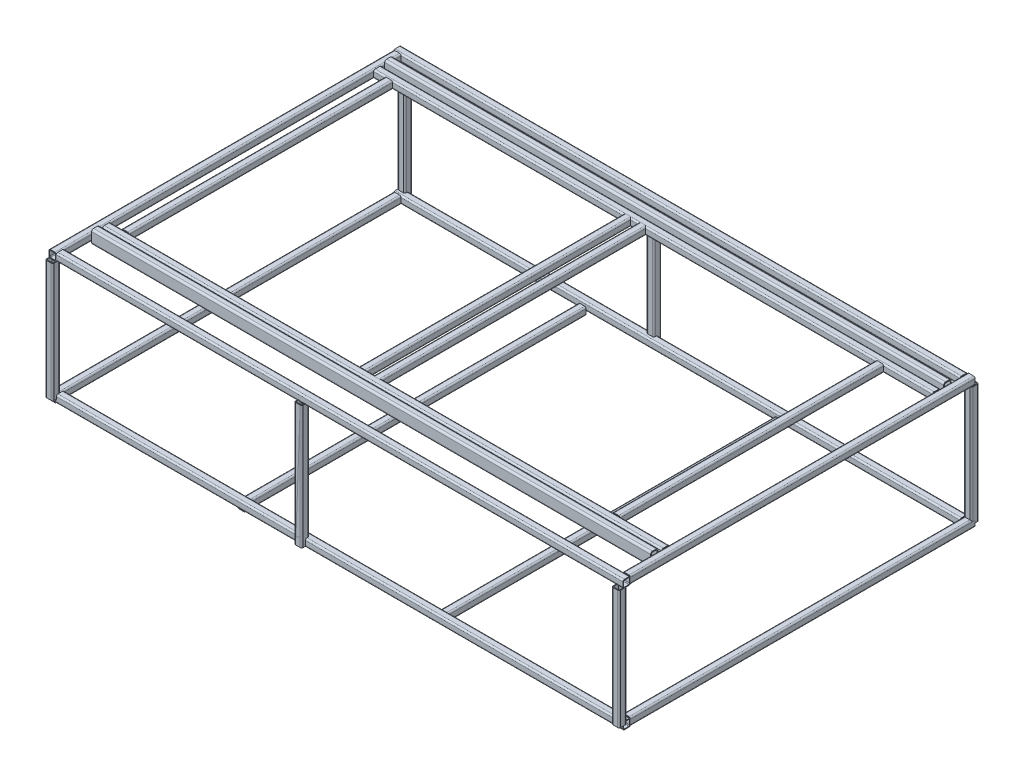
from build123d import *

# Parameters (mm, degrees)
SQUARE_TUBE_40_X_40_X_4_1_DEPTH        = 1845
SQUARE_TUBE_40_X_40_X_4_1_DEPTH_BACK   = 1
SQUARE_TUBE_40_X_40_X_4_1_2_DEPTH      = 3021
SQUARE_TUBE_40_X_40_X_4_1_3_DEPTH      = 1846
SQUARE_TUBE_40_X_40_X_4_1_4_DEPTH      = 3021
RECTANGULAR_TUBE_70_X_40_X_5_1_DEPTH   = 2960
RECTANGULAR_TUBE_70_X_40_X_5_1_2_DEPTH = 2960
SQUARE_TUBE_40_X_40_X_4_2_DEPTH        = 2960
SQUARE_TUBE_40_X_40_X_4_2_2_DEPTH      = 2960
SQUARE_TUBE_40_X_40_X_4_3_DEPTH        = 1395
SQUARE_TUBE_40_X_40_X_4_3_2_DEPTH      = 1395
SQUARE_TUBE_40_X_40_X_4_4_DEPTH        = 1411
SQUARE_TUBE_40_X_40_X_4_4_2_DEPTH      = 1407
SQUARE_TUBE_40_X_40_X_4_5_DEPTH        = 630
SQUARE_TUBE_40_X_40_X_4_5_2_DEPTH      = 653
SQUARE_TUBE_40_X_40_X_4_5_3_DEPTH      = 630
SQUARE_TUBE_40_X_40_X_4_6_DEPTH        = 630
SQUARE_TUBE_40_X_40_X_4_6_2_DEPTH      = 653
SQUARE_TUBE_40_X_40_X_4_6_3_DEPTH      = 630
SQUARE_TUBE_40_X_40_X_4_7_DEPTH        = 630
SQUARE_TUBE_40_X_40_X_4_7_2_DEPTH      = 653
SQUARE_TUBE_40_X_40_X_4_7_3_DEPTH      = 630
SQUARE_TUBE_40_X_40_X_4_8_DEPTH        = 3020
SQUARE_TUBE_40_X_40_X_4_8_DEPTH_BACK   = 1
SQUARE_TUBE_40_X_40_X_4_8_2_DEPTH      = 1846
SQUARE_TUBE_40_X_40_X_4_8_3_DEPTH      = 3021
SQUARE_TUBE_40_X_40_X_4_8_4_DEPTH      = 1846
SQUARE_TUBE_40_X_40_X_4_9_DEPTH        = 1789
SQUARE_TUBE_40_X_40_X_4_9_2_DEPTH      = 1805


with BuildPart() as part:
    # Sketch13 → Square tube 40 X 40 X 4(1) (new, two sides: drawn at the far end of the back side and taken through both)
    with BuildSketch(Plane(origin=(-1500, 0, -912.5), x_dir=(1, 0, 0), z_dir=(0, 0, 1)).offset(-SQUARE_TUBE_40_X_40_X_4_1_DEPTH_BACK)):
        with BuildLine():
            Line((-12, -20), (12, -20))
            ThreePointArc((12, -20), (17.656854249, -17.656854249), (20, -12))
            Line((20, -12), (20, 12))
            ThreePointArc((20, 12), (17.656854249, 17.656854249), (12, 20))
            Line((12, 20), (-12, 20))
            ThreePointArc((-12, 20), (-17.656854249, 17.656854249), (-20, 12))
            Line((-20, 12), (-20, -12))
            ThreePointArc((-20, -12), (-17.656854249, -17.656854249), (-12, -20))
        make_face()
        with BuildLine():
            Line((-12, -16), (12, -16))
            ThreePointArc((12, -16), (14.828427125, -14.828427125), (16, -12))
            Line((16, -12), (16, 12))
            ThreePointArc((16, 12), (14.828427125, 14.828427125), (12, 16))
            Line((12, 16), (-12, 16))
            ThreePointArc((-12, 16), (-14.828427125, 14.828427125), (-16, 12))
            Line((-16, 12), (-16, -12))
            ThreePointArc((-16, -12), (-14.828427125, -14.828427125), (-12, -16))
        make_face(mode=Mode.SUBTRACT)
    extrude(amount=SQUARE_TUBE_40_X_40_X_4_1_DEPTH + SQUARE_TUBE_40_X_40_X_4_1_DEPTH_BACK)

    # Square tube 40 X 40 X 4(1) end butt 1
    split(bisect_by=Plane(origin=(-1500, 0, -892.5), x_dir=(0, -1, 0), z_dir=(0, 0, 1)), keep=Keep.TOP)


with BuildPart() as body_2:
    # Sketch13 on segment 2 (carried to segment 2) → Square tube 40 X 40 X 4_1 2 (new body)
    with BuildSketch(Plane(origin=(-1501, 0, 912.5), x_dir=(0, 0, -1), z_dir=(1, 0, 0))):
        with BuildLine():
            Line((-12, -20), (12, -20))
            ThreePointArc((12, -20), (17.656854249, -17.656854249), (20, -12))
            Line((20, -12), (20, 12))
            ThreePointArc((20, 12), (17.656854249, 17.656854249), (12, 20))
            Line((12, 20), (-12, 20))
            ThreePointArc((-12, 20), (-17.656854249, 17.656854249), (-20, 12))
            Line((-20, 12), (-20, -12))
            ThreePointArc((-20, -12), (-17.656854249, -17.656854249), (-12, -20))
        make_face()
        with BuildLine():
            Line((-12, -16), (12, -16))
            ThreePointArc((12, -16), (14.828427125, -14.828427125), (16, -12))
            Line((16, -12), (16, 12))
            ThreePointArc((16, 12), (14.828427125, 14.828427125), (12, 16))
            Line((12, 16), (-12, 16))
            ThreePointArc((-12, 16), (-14.828427125, 14.828427125), (-16, 12))
            Line((-16, 12), (-16, -12))
            ThreePointArc((-16, -12), (-14.828427125, -14.828427125), (-12, -16))
        make_face(mode=Mode.SUBTRACT)
    extrude(amount=SQUARE_TUBE_40_X_40_X_4_1_2_DEPTH)

    # Square tube 40 X 40 X 4_1 2 end butt 1
    split(bisect_by=Plane(origin=(-1480, 0, 912.5), x_dir=(0, 1, 0), z_dir=(1, 0, 0)), keep=Keep.TOP)


with BuildPart() as body_3:
    # Sketch13 on segment 3 (carried to segment 3) → Square tube 40 X 40 X 4_1 3 (new body)
    with BuildSketch(Plane(origin=(1500, 0, 913.5), x_dir=(-1, 0, 0), z_dir=(0, 0, -1))):
        with BuildLine():
            Line((-12, -20), (12, -20))
            ThreePointArc((12, -20), (17.656854249, -17.656854249), (20, -12))
            Line((20, -12), (20, 12))
            ThreePointArc((20, 12), (17.656854249, 17.656854249), (12, 20))
            Line((12, 20), (-12, 20))
            ThreePointArc((-12, 20), (-17.656854249, 17.656854249), (-20, 12))
            Line((-20, 12), (-20, -12))
            ThreePointArc((-20, -12), (-17.656854249, -17.656854249), (-12, -20))
        make_face()
        with BuildLine():
            Line((-12, -16), (12, -16))
            ThreePointArc((12, -16), (14.828427125, -14.828427125), (16, -12))
            Line((16, -12), (16, 12))
            ThreePointArc((16, 12), (14.828427125, 14.828427125), (12, 16))
            Line((12, 16), (-12, 16))
            ThreePointArc((-12, 16), (-14.828427125, 14.828427125), (-16, 12))
            Line((-16, 12), (-16, -12))
            ThreePointArc((-16, -12), (-14.828427125, -14.828427125), (-12, -16))
        make_face(mode=Mode.SUBTRACT)
    extrude(amount=SQUARE_TUBE_40_X_40_X_4_1_3_DEPTH)

    # Square tube 40 X 40 X 4_1 3 end butt 1
    split(bisect_by=Plane(origin=(1500, 0, 892.5), x_dir=(0, 1, 0), z_dir=(0, 0, -1)), keep=Keep.TOP)


with BuildPart() as body_4:
    # Sketch13 on segment 4 (carried to segment 4) → Square tube 40 X 40 X 4_1 4 (new body)
    with BuildSketch(Plane(origin=(1501, 0, -912.5), x_dir=(0, 0, 1), z_dir=(-1, 0, 0))):
        with BuildLine():
            Line((-12, -20), (12, -20))
            ThreePointArc((12, -20), (17.656854249, -17.656854249), (20, -12))
            Line((20, -12), (20, 12))
            ThreePointArc((20, 12), (17.656854249, 17.656854249), (12, 20))
            Line((12, 20), (-12, 20))
            ThreePointArc((-12, 20), (-17.656854249, 17.656854249), (-20, 12))
            Line((-20, 12), (-20, -12))
            ThreePointArc((-20, -12), (-17.656854249, -17.656854249), (-12, -20))
        make_face()
        with BuildLine():
            Line((-12, -16), (12, -16))
            ThreePointArc((12, -16), (14.828427125, -14.828427125), (16, -12))
            Line((16, -12), (16, 12))
            ThreePointArc((16, 12), (14.828427125, 14.828427125), (12, 16))
            Line((12, 16), (-12, 16))
            ThreePointArc((-12, 16), (-14.828427125, 14.828427125), (-16, 12))
            Line((-16, 12), (-16, -12))
            ThreePointArc((-16, -12), (-14.828427125, -14.828427125), (-12, -16))
        make_face(mode=Mode.SUBTRACT)
    extrude(amount=SQUARE_TUBE_40_X_40_X_4_1_4_DEPTH)

    # Square tube 40 X 40 X 4_1 4 end butt 1
    split(bisect_by=Plane(origin=(1480, 0, -912.5), x_dir=(0, -1, 0), z_dir=(-1, 0, 0)), keep=Keep.TOP)


with BuildPart() as body_5:
    # Sketch17 → Rectangular tube 70 X 40 X 5(1) (new body)
    with BuildSketch(Plane(origin=(-1480, 0, -826), x_dir=(0, 0, -1), z_dir=(1, 0, 0))):
        with BuildLine():
            Line((-10, -35), (10, -35))
            ThreePointArc((10, -35), (17.071067812, -32.071067812), (20, -25))
            Line((20, -25), (20, 25))
            ThreePointArc((20, 25), (17.071067812, 32.071067812), (10, 35))
            Line((10, 35), (-10, 35))
            ThreePointArc((-10, 35), (-17.071067812, 32.071067812), (-20, 25))
            Line((-20, 25), (-20, -25))
            ThreePointArc((-20, -25), (-17.071067812, -32.071067812), (-10, -35))
        make_face()
        with BuildLine():
            Line((-10, -30), (10, -30))
            ThreePointArc((10, -30), (13.535533906, -28.535533906), (15, -25))
            Line((15, -25), (15, 25))
            ThreePointArc((15, 25), (13.535533906, 28.535533906), (10, 30))
            Line((10, 30), (-10, 30))
            ThreePointArc((-10, 30), (-13.535533906, 28.535533906), (-15, 25))
            Line((-15, 25), (-15, -25))
            ThreePointArc((-15, -25), (-13.535533906, -28.535533906), (-10, -30))
        make_face(mode=Mode.SUBTRACT)
    extrude(amount=RECTANGULAR_TUBE_70_X_40_X_5_1_DEPTH)


with BuildPart() as body_6:
    # Sketch17 on segment 2 (carried to segment 2) → Rectangular tube 70 X 40 X 5_1 2 (new body)
    with BuildSketch(Plane(origin=(-1480, 0, 726), x_dir=(0, 0, -1), z_dir=(1, 0, 0))):
        with BuildLine():
            Line((-10, -35), (10, -35))
            ThreePointArc((10, -35), (17.071067812, -32.071067812), (20, -25))
            Line((20, -25), (20, 25))
            ThreePointArc((20, 25), (17.071067812, 32.071067812), (10, 35))
            Line((10, 35), (-10, 35))
            ThreePointArc((-10, 35), (-17.071067812, 32.071067812), (-20, 25))
            Line((-20, 25), (-20, -25))
            ThreePointArc((-20, -25), (-17.071067812, -32.071067812), (-10, -35))
        make_face()
        with BuildLine():
            Line((-10, -30), (10, -30))
            ThreePointArc((10, -30), (13.535533906, -28.535533906), (15, -25))
            Line((15, -25), (15, 25))
            ThreePointArc((15, 25), (13.535533906, 28.535533906), (10, 30))
            Line((10, 30), (-10, 30))
            ThreePointArc((-10, 30), (-13.535533906, 28.535533906), (-15, 25))
            Line((-15, 25), (-15, -25))
            ThreePointArc((-15, -25), (-13.535533906, -28.535533906), (-10, -30))
        make_face(mode=Mode.SUBTRACT)
    extrude(amount=RECTANGULAR_TUBE_70_X_40_X_5_1_2_DEPTH)


with BuildPart() as body_7:
    # Sketch110 → Square tube 40 X 40 X 4(2) (new body)
    with BuildSketch(Plane(origin=(-1480, 0, -767.5), x_dir=(0, 0, -1), z_dir=(1, 0, 0))):
        with BuildLine():
            Line((-12, -20), (12, -20))
            ThreePointArc((12, -20), (17.656854249, -17.656854249), (20, -12))
            Line((20, -12), (20, 12))
            ThreePointArc((20, 12), (17.656854249, 17.656854249), (12, 20))
            Line((12, 20), (-12, 20))
            ThreePointArc((-12, 20), (-17.656854249, 17.656854249), (-20, 12))
            Line((-20, 12), (-20, -12))
            ThreePointArc((-20, -12), (-17.656854249, -17.656854249), (-12, -20))
        make_face()
        with BuildLine():
            Line((-12, -16), (12, -16))
            ThreePointArc((12, -16), (14.828427125, -14.828427125), (16, -12))
            Line((16, -12), (16, 12))
            ThreePointArc((16, 12), (14.828427125, 14.828427125), (12, 16))
            Line((12, 16), (-12, 16))
            ThreePointArc((-12, 16), (-14.828427125, 14.828427125), (-16, 12))
            Line((-16, 12), (-16, -12))
            ThreePointArc((-16, -12), (-14.828427125, -14.828427125), (-12, -16))
        make_face(mode=Mode.SUBTRACT)
    extrude(amount=SQUARE_TUBE_40_X_40_X_4_2_DEPTH)


with BuildPart() as body_8:
    # Sketch110 on segment 2 (carried to segment 2) → Square tube 40 X 40 X 4_2 2 (new body)
    with BuildSketch(Plane(origin=(-1480, 0, 667.5), x_dir=(0, 0, -1), z_dir=(1, 0, 0))):
        with BuildLine():
            Line((-12, -20), (12, -20))
            ThreePointArc((12, -20), (17.656854249, -17.656854249), (20, -12))
            Line((20, -12), (20, 12))
            ThreePointArc((20, 12), (17.656854249, 17.656854249), (12, 20))
            Line((12, 20), (-12, 20))
            ThreePointArc((-12, 20), (-17.656854249, 17.656854249), (-20, 12))
            Line((-20, 12), (-20, -12))
            ThreePointArc((-20, -12), (-17.656854249, -17.656854249), (-12, -20))
        make_face()
        with BuildLine():
            Line((-12, -16), (12, -16))
            ThreePointArc((12, -16), (14.828427125, -14.828427125), (16, -12))
            Line((16, -12), (16, 12))
            ThreePointArc((16, 12), (14.828427125, 14.828427125), (12, 16))
            Line((12, 16), (-12, 16))
            ThreePointArc((-12, 16), (-14.828427125, 14.828427125), (-16, 12))
            Line((-16, 12), (-16, -12))
            ThreePointArc((-16, -12), (-14.828427125, -14.828427125), (-12, -16))
        make_face(mode=Mode.SUBTRACT)
    extrude(amount=SQUARE_TUBE_40_X_40_X_4_2_2_DEPTH)


with BuildPart() as body_9:
    # Sketch112 → Square tube 40 X 40 X 4(3) (new body)
    with BuildSketch(Plane(origin=(1200, 0, -747.5), x_dir=(1, 0, 0), z_dir=(0, 0, 1))):
        with BuildLine():
            Line((-12, -20), (12, -20))
            ThreePointArc((12, -20), (17.656854249, -17.656854249), (20, -12))
            Line((20, -12), (20, 12))
            ThreePointArc((20, 12), (17.656854249, 17.656854249), (12, 20))
            Line((12, 20), (-12, 20))
            ThreePointArc((-12, 20), (-17.656854249, 17.656854249), (-20, 12))
            Line((-20, 12), (-20, -12))
            ThreePointArc((-20, -12), (-17.656854249, -17.656854249), (-12, -20))
        make_face()
        with BuildLine():
            Line((-12, -16), (12, -16))
            ThreePointArc((12, -16), (14.828427125, -14.828427125), (16, -12))
            Line((16, -12), (16, 12))
            ThreePointArc((16, 12), (14.828427125, 14.828427125), (12, 16))
            Line((12, 16), (-12, 16))
            ThreePointArc((-12, 16), (-14.828427125, 14.828427125), (-16, 12))
            Line((-16, 12), (-16, -12))
            ThreePointArc((-16, -12), (-14.828427125, -14.828427125), (-12, -16))
        make_face(mode=Mode.SUBTRACT)
    extrude(amount=SQUARE_TUBE_40_X_40_X_4_3_DEPTH)


with BuildPart() as body_10:
    # Sketch112 on segment 2 (carried to segment 2) → Square tube 40 X 40 X 4_3 2 (new body)
    with BuildSketch(Plane(origin=(-1400, 0, -747.5), x_dir=(1, 0, 0), z_dir=(0, 0, 1))):
        with BuildLine():
            Line((-12, -20), (12, -20))
            ThreePointArc((12, -20), (17.656854249, -17.656854249), (20, -12))
            Line((20, -12), (20, 12))
            ThreePointArc((20, 12), (17.656854249, 17.656854249), (12, 20))
            Line((12, 20), (-12, 20))
            ThreePointArc((-12, 20), (-17.656854249, 17.656854249), (-20, 12))
            Line((-20, 12), (-20, -12))
            ThreePointArc((-20, -12), (-17.656854249, -17.656854249), (-12, -20))
        make_face()
        with BuildLine():
            Line((-12, -16), (12, -16))
            ThreePointArc((12, -16), (14.828427125, -14.828427125), (16, -12))
            Line((16, -12), (16, 12))
            ThreePointArc((16, 12), (14.828427125, 14.828427125), (12, 16))
            Line((12, 16), (-12, 16))
            ThreePointArc((-12, 16), (-14.828427125, 14.828427125), (-16, 12))
            Line((-16, 12), (-16, -12))
            ThreePointArc((-16, -12), (-14.828427125, -14.828427125), (-12, -16))
        make_face(mode=Mode.SUBTRACT)
    extrude(amount=SQUARE_TUBE_40_X_40_X_4_3_2_DEPTH)


with BuildPart() as body_11:
    # Sketch114 → Square tube 40 X 40 X 4(4) (new body)
    with BuildSketch(Plane(origin=(-60, 0, -755.5), x_dir=(1, 0, 0), z_dir=(0, 0, 1))):
        with BuildLine():
            Line((-12, -20), (12, -20))
            ThreePointArc((12, -20), (17.656854249, -17.656854249), (20, -12))
            Line((20, -12), (20, 12))
            ThreePointArc((20, 12), (17.656854249, 17.656854249), (12, 20))
            Line((12, 20), (-12, 20))
            ThreePointArc((-12, 20), (-17.656854249, 17.656854249), (-20, 12))
            Line((-20, 12), (-20, -12))
            ThreePointArc((-20, -12), (-17.656854249, -17.656854249), (-12, -20))
        make_face()
        with BuildLine():
            Line((-12, -16), (12, -16))
            ThreePointArc((12, -16), (14.828427125, -14.828427125), (16, -12))
            Line((16, -12), (16, 12))
            ThreePointArc((16, 12), (14.828427125, 14.828427125), (12, 16))
            Line((12, 16), (-12, 16))
            ThreePointArc((-12, 16), (-14.828427125, 14.828427125), (-16, 12))
            Line((-16, 12), (-16, -12))
            ThreePointArc((-16, -12), (-14.828427125, -14.828427125), (-12, -16))
        make_face(mode=Mode.SUBTRACT)
    extrude(amount=SQUARE_TUBE_40_X_40_X_4_4_DEPTH)


with BuildPart() as body_12:
    # Sketch114 on segment 2 (carried to segment 2) → Square tube 40 X 40 X 4_4 2 (new body)
    with BuildSketch(Plane(origin=(-140, 0, -755.5), x_dir=(1, 0, 0), z_dir=(0, 0, 1))):
        with BuildLine():
            Line((-12, -20), (12, -20))
            ThreePointArc((12, -20), (17.656854249, -17.656854249), (20, -12))
            Line((20, -12), (20, 12))
            ThreePointArc((20, 12), (17.656854249, 17.656854249), (12, 20))
            Line((12, 20), (-12, 20))
            ThreePointArc((-12, 20), (-17.656854249, 17.656854249), (-20, 12))
            Line((-20, 12), (-20, -12))
            ThreePointArc((-20, -12), (-17.656854249, -17.656854249), (-12, -20))
        make_face()
        with BuildLine():
            Line((-12, -16), (12, -16))
            ThreePointArc((12, -16), (14.828427125, -14.828427125), (16, -12))
            Line((16, -12), (16, 12))
            ThreePointArc((16, 12), (14.828427125, 14.828427125), (12, 16))
            Line((12, 16), (-12, 16))
            ThreePointArc((-12, 16), (-14.828427125, 14.828427125), (-16, 12))
            Line((-16, 12), (-16, -12))
            ThreePointArc((-16, -12), (-14.828427125, -14.828427125), (-12, -16))
        make_face(mode=Mode.SUBTRACT)
    extrude(amount=SQUARE_TUBE_40_X_40_X_4_4_2_DEPTH)


with BuildPart() as body_13:
    # Sketch116 → Square tube 40 X 40 X 4(5) (new body)
    with BuildSketch(Plane(origin=(-1500, -20, 932.5), x_dir=(1, 0, 0), z_dir=(0, -1, 0))):
        with BuildLine():
            Line((-12, -20), (12, -20))
            ThreePointArc((12, -20), (17.656854249, -17.656854249), (20, -12))
            Line((20, -12), (20, 12))
            ThreePointArc((20, 12), (17.656854249, 17.656854249), (12, 20))
            Line((12, 20), (-12, 20))
            ThreePointArc((-12, 20), (-17.656854249, 17.656854249), (-20, 12))
            Line((-20, 12), (-20, -12))
            ThreePointArc((-20, -12), (-17.656854249, -17.656854249), (-12, -20))
        make_face()
        with BuildLine():
            Line((-12, -16), (12, -16))
            ThreePointArc((12, -16), (14.828427125, -14.828427125), (16, -12))
            Line((16, -12), (16, 12))
            ThreePointArc((16, 12), (14.828427125, 14.828427125), (12, 16))
            Line((12, 16), (-12, 16))
            ThreePointArc((-12, 16), (-14.828427125, 14.828427125), (-16, 12))
            Line((-16, 12), (-16, -12))
            ThreePointArc((-16, -12), (-14.828427125, -14.828427125), (-12, -16))
        make_face(mode=Mode.SUBTRACT)
    extrude(amount=SQUARE_TUBE_40_X_40_X_4_5_DEPTH)


with BuildPart() as body_14:
    # Sketch116 on segment 2 (carried to segment 2) → Square tube 40 X 40 X 4_5 2 (new body)
    with BuildSketch(Plane(origin=(-181, -12, 932.5), x_dir=(1, 0, 0), z_dir=(0, -1, 0))):
        with BuildLine():
            Line((-12, -20), (12, -20))
            ThreePointArc((12, -20), (17.656854249, -17.656854249), (20, -12))
            Line((20, -12), (20, 12))
            ThreePointArc((20, 12), (17.656854249, 17.656854249), (12, 20))
            Line((12, 20), (-12, 20))
            ThreePointArc((-12, 20), (-17.656854249, 17.656854249), (-20, 12))
            Line((-20, 12), (-20, -12))
            ThreePointArc((-20, -12), (-17.656854249, -17.656854249), (-12, -20))
        make_face()
        with BuildLine():
            Line((-12, -16), (12, -16))
            ThreePointArc((12, -16), (14.828427125, -14.828427125), (16, -12))
            Line((16, -12), (16, 12))
            ThreePointArc((16, 12), (14.828427125, 14.828427125), (12, 16))
            Line((12, 16), (-12, 16))
            ThreePointArc((-12, 16), (-14.828427125, 14.828427125), (-16, 12))
            Line((-16, 12), (-16, -12))
            ThreePointArc((-16, -12), (-14.828427125, -14.828427125), (-12, -16))
        make_face(mode=Mode.SUBTRACT)
    extrude(amount=SQUARE_TUBE_40_X_40_X_4_5_2_DEPTH)


with BuildPart() as body_15:
    # Sketch116 on segment 3 (carried to segment 3) → Square tube 40 X 40 X 4_5 3 (new body)
    with BuildSketch(Plane(origin=(1500, -20, 932.5), x_dir=(1, 0, 0), z_dir=(0, -1, 0))):
        with BuildLine():
            Line((-12, -20), (12, -20))
            ThreePointArc((12, -20), (17.656854249, -17.656854249), (20, -12))
            Line((20, -12), (20, 12))
            ThreePointArc((20, 12), (17.656854249, 17.656854249), (12, 20))
            Line((12, 20), (-12, 20))
            ThreePointArc((-12, 20), (-17.656854249, 17.656854249), (-20, 12))
            Line((-20, 12), (-20, -12))
            ThreePointArc((-20, -12), (-17.656854249, -17.656854249), (-12, -20))
        make_face()
        with BuildLine():
            Line((-12, -16), (12, -16))
            ThreePointArc((12, -16), (14.828427125, -14.828427125), (16, -12))
            Line((16, -12), (16, 12))
            ThreePointArc((16, 12), (14.828427125, 14.828427125), (12, 16))
            Line((12, 16), (-12, 16))
            ThreePointArc((-12, 16), (-14.828427125, 14.828427125), (-16, 12))
            Line((-16, 12), (-16, -12))
            ThreePointArc((-16, -12), (-14.828427125, -14.828427125), (-12, -16))
        make_face(mode=Mode.SUBTRACT)
    extrude(amount=SQUARE_TUBE_40_X_40_X_4_5_3_DEPTH)


with BuildPart() as body_16:
    # Sketch118 → Square tube 40 X 40 X 4(6) (new body)
    with BuildSketch(Plane(origin=(1500, -20, 932.5), x_dir=(1, 0, 0), z_dir=(0, -1, 0))):
        with BuildLine():
            Line((-12, -20), (12, -20))
            ThreePointArc((12, -20), (17.656854249, -17.656854249), (20, -12))
            Line((20, -12), (20, 12))
            ThreePointArc((20, 12), (17.656854249, 17.656854249), (12, 20))
            Line((12, 20), (-12, 20))
            ThreePointArc((-12, 20), (-17.656854249, 17.656854249), (-20, 12))
            Line((-20, 12), (-20, -12))
            ThreePointArc((-20, -12), (-17.656854249, -17.656854249), (-12, -20))
        make_face()
        with BuildLine():
            Line((-12, -16), (12, -16))
            ThreePointArc((12, -16), (14.828427125, -14.828427125), (16, -12))
            Line((16, -12), (16, 12))
            ThreePointArc((16, 12), (14.828427125, 14.828427125), (12, 16))
            Line((12, 16), (-12, 16))
            ThreePointArc((-12, 16), (-14.828427125, 14.828427125), (-16, 12))
            Line((-16, 12), (-16, -12))
            ThreePointArc((-16, -12), (-14.828427125, -14.828427125), (-12, -16))
        make_face(mode=Mode.SUBTRACT)
    extrude(amount=SQUARE_TUBE_40_X_40_X_4_6_DEPTH)


with BuildPart() as body_17:
    # Sketch118 on segment 2 (carried to segment 2) → Square tube 40 X 40 X 4_6 2 (new body)
    with BuildSketch(Plane(origin=(-181, -12, 932.5), x_dir=(1, 0, 0), z_dir=(0, -1, 0))):
        with BuildLine():
            Line((-12, -20), (12, -20))
            ThreePointArc((12, -20), (17.656854249, -17.656854249), (20, -12))
            Line((20, -12), (20, 12))
            ThreePointArc((20, 12), (17.656854249, 17.656854249), (12, 20))
            Line((12, 20), (-12, 20))
            ThreePointArc((-12, 20), (-17.656854249, 17.656854249), (-20, 12))
            Line((-20, 12), (-20, -12))
            ThreePointArc((-20, -12), (-17.656854249, -17.656854249), (-12, -20))
        make_face()
        with BuildLine():
            Line((-12, -16), (12, -16))
            ThreePointArc((12, -16), (14.828427125, -14.828427125), (16, -12))
            Line((16, -12), (16, 12))
            ThreePointArc((16, 12), (14.828427125, 14.828427125), (12, 16))
            Line((12, 16), (-12, 16))
            ThreePointArc((-12, 16), (-14.828427125, 14.828427125), (-16, 12))
            Line((-16, 12), (-16, -12))
            ThreePointArc((-16, -12), (-14.828427125, -14.828427125), (-12, -16))
        make_face(mode=Mode.SUBTRACT)
    extrude(amount=SQUARE_TUBE_40_X_40_X_4_6_2_DEPTH)


with BuildPart() as body_18:
    # Sketch118 on segment 3 (carried to segment 3) → Square tube 40 X 40 X 4_6 3 (new body)
    with BuildSketch(Plane(origin=(-1500, -20, 932.5), x_dir=(1, 0, 0), z_dir=(0, -1, 0))):
        with BuildLine():
            Line((-12, -20), (12, -20))
            ThreePointArc((12, -20), (17.656854249, -17.656854249), (20, -12))
            Line((20, -12), (20, 12))
            ThreePointArc((20, 12), (17.656854249, 17.656854249), (12, 20))
            Line((12, 20), (-12, 20))
            ThreePointArc((-12, 20), (-17.656854249, 17.656854249), (-20, 12))
            Line((-20, 12), (-20, -12))
            ThreePointArc((-20, -12), (-17.656854249, -17.656854249), (-12, -20))
        make_face()
        with BuildLine():
            Line((-12, -16), (12, -16))
            ThreePointArc((12, -16), (14.828427125, -14.828427125), (16, -12))
            Line((16, -12), (16, 12))
            ThreePointArc((16, 12), (14.828427125, 14.828427125), (12, 16))
            Line((12, 16), (-12, 16))
            ThreePointArc((-12, 16), (-14.828427125, 14.828427125), (-16, 12))
            Line((-16, 12), (-16, -12))
            ThreePointArc((-16, -12), (-14.828427125, -14.828427125), (-12, -16))
        make_face(mode=Mode.SUBTRACT)
    extrude(amount=SQUARE_TUBE_40_X_40_X_4_6_3_DEPTH)


with BuildPart() as body_19:
    # Sketch119 → Square tube 40 X 40 X 4(7) (new body)
    with BuildSketch(Plane(origin=(1500, -20, -932.5), x_dir=(-1, 0, 0), z_dir=(0, -1, 0))):
        with BuildLine():
            Line((-12, -20), (12, -20))
            ThreePointArc((12, -20), (17.656854249, -17.656854249), (20, -12))
            Line((20, -12), (20, 12))
            ThreePointArc((20, 12), (17.656854249, 17.656854249), (12, 20))
            Line((12, 20), (-12, 20))
            ThreePointArc((-12, 20), (-17.656854249, 17.656854249), (-20, 12))
            Line((-20, 12), (-20, -12))
            ThreePointArc((-20, -12), (-17.656854249, -17.656854249), (-12, -20))
        make_face()
        with BuildLine():
            Line((-12, -16), (12, -16))
            ThreePointArc((12, -16), (14.828427125, -14.828427125), (16, -12))
            Line((16, -12), (16, 12))
            ThreePointArc((16, 12), (14.828427125, 14.828427125), (12, 16))
            Line((12, 16), (-12, 16))
            ThreePointArc((-12, 16), (-14.828427125, 14.828427125), (-16, 12))
            Line((-16, 12), (-16, -12))
            ThreePointArc((-16, -12), (-14.828427125, -14.828427125), (-12, -16))
        make_face(mode=Mode.SUBTRACT)
    extrude(amount=SQUARE_TUBE_40_X_40_X_4_7_DEPTH)


with BuildPart() as body_20:
    # Sketch119 on segment 2 (carried to segment 2) → Square tube 40 X 40 X 4_7 2 (new body)
    with BuildSketch(Plane(origin=(-181, -12, -932.5), x_dir=(-1, 0, 0), z_dir=(0, -1, 0))):
        with BuildLine():
            Line((-12, -20), (12, -20))
            ThreePointArc((12, -20), (17.656854249, -17.656854249), (20, -12))
            Line((20, -12), (20, 12))
            ThreePointArc((20, 12), (17.656854249, 17.656854249), (12, 20))
            Line((12, 20), (-12, 20))
            ThreePointArc((-12, 20), (-17.656854249, 17.656854249), (-20, 12))
            Line((-20, 12), (-20, -12))
            ThreePointArc((-20, -12), (-17.656854249, -17.656854249), (-12, -20))
        make_face()
        with BuildLine():
            Line((-12, -16), (12, -16))
            ThreePointArc((12, -16), (14.828427125, -14.828427125), (16, -12))
            Line((16, -12), (16, 12))
            ThreePointArc((16, 12), (14.828427125, 14.828427125), (12, 16))
            Line((12, 16), (-12, 16))
            ThreePointArc((-12, 16), (-14.828427125, 14.828427125), (-16, 12))
            Line((-16, 12), (-16, -12))
            ThreePointArc((-16, -12), (-14.828427125, -14.828427125), (-12, -16))
        make_face(mode=Mode.SUBTRACT)
    extrude(amount=SQUARE_TUBE_40_X_40_X_4_7_2_DEPTH)


with BuildPart() as body_21:
    # Sketch119 on segment 3 (carried to segment 3) → Square tube 40 X 40 X 4_7 3 (new body)
    with BuildSketch(Plane(origin=(-1500, -20, -932.5), x_dir=(-1, 0, 0), z_dir=(0, -1, 0))):
        with BuildLine():
            Line((-12, -20), (12, -20))
            ThreePointArc((12, -20), (17.656854249, -17.656854249), (20, -12))
            Line((20, -12), (20, 12))
            ThreePointArc((20, 12), (17.656854249, 17.656854249), (12, 20))
            Line((12, 20), (-12, 20))
            ThreePointArc((-12, 20), (-17.656854249, 17.656854249), (-20, 12))
            Line((-20, 12), (-20, -12))
            ThreePointArc((-20, -12), (-17.656854249, -17.656854249), (-12, -20))
        make_face()
        with BuildLine():
            Line((-12, -16), (12, -16))
            ThreePointArc((12, -16), (14.828427125, -14.828427125), (16, -12))
            Line((16, -12), (16, 12))
            ThreePointArc((16, 12), (14.828427125, 14.828427125), (12, 16))
            Line((12, 16), (-12, 16))
            ThreePointArc((-12, 16), (-14.828427125, 14.828427125), (-16, 12))
            Line((-16, 12), (-16, -12))
            ThreePointArc((-16, -12), (-14.828427125, -14.828427125), (-12, -16))
        make_face(mode=Mode.SUBTRACT)
    extrude(amount=SQUARE_TUBE_40_X_40_X_4_7_3_DEPTH)


with BuildPart() as body_22:
    # Sketch121 → Square tube 40 X 40 X 4(8) (new, two sides: drawn at the far end of the back side and taken through both)
    with BuildSketch(Plane(origin=(-1500, -650, 912.5), x_dir=(0, 0, 1), z_dir=(1, 0, 0)).offset(-SQUARE_TUBE_40_X_40_X_4_8_DEPTH_BACK)):
        with BuildLine():
            Line((-12, -20), (12, -20))
            ThreePointArc((12, -20), (17.656854249, -17.656854249), (20, -12))
            Line((20, -12), (20, 12))
            ThreePointArc((20, 12), (17.656854249, 17.656854249), (12, 20))
            Line((12, 20), (-12, 20))
            ThreePointArc((-12, 20), (-17.656854249, 17.656854249), (-20, 12))
            Line((-20, 12), (-20, -12))
            ThreePointArc((-20, -12), (-17.656854249, -17.656854249), (-12, -20))
        make_face()
        with BuildLine():
            Line((-12, -16), (12, -16))
            ThreePointArc((12, -16), (14.828427125, -14.828427125), (16, -12))
            Line((16, -12), (16, 12))
            ThreePointArc((16, 12), (14.828427125, 14.828427125), (12, 16))
            Line((12, 16), (-12, 16))
            ThreePointArc((-12, 16), (-14.828427125, 14.828427125), (-16, 12))
            Line((-16, 12), (-16, -12))
            ThreePointArc((-16, -12), (-14.828427125, -14.828427125), (-12, -16))
        make_face(mode=Mode.SUBTRACT)
    extrude(amount=SQUARE_TUBE_40_X_40_X_4_8_DEPTH + SQUARE_TUBE_40_X_40_X_4_8_DEPTH_BACK)

    # Square tube 40 X 40 X 4(8) end butt 1
    split(bisect_by=Plane(origin=(-1480, -650, 912.5), x_dir=(0, 1, 0), z_dir=(1, 0, 0)), keep=Keep.TOP)


with BuildPart() as body_23:
    # Sketch121 on segment 2 (carried to segment 2) → Square tube 40 X 40 X 4_8 2 (new body)
    with BuildSketch(Plane(origin=(1500, -650, 913.5), x_dir=(1, 0, 0), z_dir=(0, 0, -1))):
        with BuildLine():
            Line((-12, -20), (12, -20))
            ThreePointArc((12, -20), (17.656854249, -17.656854249), (20, -12))
            Line((20, -12), (20, 12))
            ThreePointArc((20, 12), (17.656854249, 17.656854249), (12, 20))
            Line((12, 20), (-12, 20))
            ThreePointArc((-12, 20), (-17.656854249, 17.656854249), (-20, 12))
            Line((-20, 12), (-20, -12))
            ThreePointArc((-20, -12), (-17.656854249, -17.656854249), (-12, -20))
        make_face()
        with BuildLine():
            Line((-12, -16), (12, -16))
            ThreePointArc((12, -16), (14.828427125, -14.828427125), (16, -12))
            Line((16, -12), (16, 12))
            ThreePointArc((16, 12), (14.828427125, 14.828427125), (12, 16))
            Line((12, 16), (-12, 16))
            ThreePointArc((-12, 16), (-14.828427125, 14.828427125), (-16, 12))
            Line((-16, 12), (-16, -12))
            ThreePointArc((-16, -12), (-14.828427125, -14.828427125), (-12, -16))
        make_face(mode=Mode.SUBTRACT)
    extrude(amount=SQUARE_TUBE_40_X_40_X_4_8_2_DEPTH)

    # Square tube 40 X 40 X 4_8 2 end butt 1
    split(bisect_by=Plane(origin=(1500, -650, 892.5), x_dir=(0, 1, 0), z_dir=(0, 0, -1)), keep=Keep.TOP)


with BuildPart() as body_24:
    # Sketch121 on segment 3 (carried to segment 3) → Square tube 40 X 40 X 4_8 3 (new body)
    with BuildSketch(Plane(origin=(1501, -650, -912.5), x_dir=(0, 0, -1), z_dir=(-1, 0, 0))):
        with BuildLine():
            Line((-12, -20), (12, -20))
            ThreePointArc((12, -20), (17.656854249, -17.656854249), (20, -12))
            Line((20, -12), (20, 12))
            ThreePointArc((20, 12), (17.656854249, 17.656854249), (12, 20))
            Line((12, 20), (-12, 20))
            ThreePointArc((-12, 20), (-17.656854249, 17.656854249), (-20, 12))
            Line((-20, 12), (-20, -12))
            ThreePointArc((-20, -12), (-17.656854249, -17.656854249), (-12, -20))
        make_face()
        with BuildLine():
            Line((-12, -16), (12, -16))
            ThreePointArc((12, -16), (14.828427125, -14.828427125), (16, -12))
            Line((16, -12), (16, 12))
            ThreePointArc((16, 12), (14.828427125, 14.828427125), (12, 16))
            Line((12, 16), (-12, 16))
            ThreePointArc((-12, 16), (-14.828427125, 14.828427125), (-16, 12))
            Line((-16, 12), (-16, -12))
            ThreePointArc((-16, -12), (-14.828427125, -14.828427125), (-12, -16))
        make_face(mode=Mode.SUBTRACT)
    extrude(amount=SQUARE_TUBE_40_X_40_X_4_8_3_DEPTH)

    # Square tube 40 X 40 X 4_8 3 end butt 1
    split(bisect_by=Plane(origin=(1480, -650, -912.5), x_dir=(0, -1, 0), z_dir=(-1, 0, 0)), keep=Keep.TOP)


with BuildPart() as body_25:
    # Sketch121 on segment 4 (carried to segment 4) → Square tube 40 X 40 X 4_8 4 (new body)
    with BuildSketch(Plane(origin=(-1500, -650, -913.5), x_dir=(-1, 0, 0), z_dir=(0, 0, 1))):
        with BuildLine():
            Line((-12, -20), (12, -20))
            ThreePointArc((12, -20), (17.656854249, -17.656854249), (20, -12))
            Line((20, -12), (20, 12))
            ThreePointArc((20, 12), (17.656854249, 17.656854249), (12, 20))
            Line((12, 20), (-12, 20))
            ThreePointArc((-12, 20), (-17.656854249, 17.656854249), (-20, 12))
            Line((-20, 12), (-20, -12))
            ThreePointArc((-20, -12), (-17.656854249, -17.656854249), (-12, -20))
        make_face()
        with BuildLine():
            Line((-12, -16), (12, -16))
            ThreePointArc((12, -16), (14.828427125, -14.828427125), (16, -12))
            Line((16, -12), (16, 12))
            ThreePointArc((16, 12), (14.828427125, 14.828427125), (12, 16))
            Line((12, 16), (-12, 16))
            ThreePointArc((-12, 16), (-14.828427125, 14.828427125), (-16, 12))
            Line((-16, 12), (-16, -12))
            ThreePointArc((-16, -12), (-14.828427125, -14.828427125), (-12, -16))
        make_face(mode=Mode.SUBTRACT)
    extrude(amount=SQUARE_TUBE_40_X_40_X_4_8_4_DEPTH)

    # Square tube 40 X 40 X 4_8 4 end butt 1
    split(bisect_by=Plane(origin=(-1500, -650, -892.5), x_dir=(0, -1, 0), z_dir=(0, 0, 1)), keep=Keep.TOP)


with BuildPart() as body_26:
    # Sketch123 → Square tube 40 X 40 X 4(9) (new body)
    with BuildSketch(Plane(origin=(520, -670, 892.5), x_dir=(1, 0, 0), z_dir=(0, 0, -1))):
        with BuildLine():
            Line((-12, -20), (12, -20))
            ThreePointArc((12, -20), (17.656854249, -17.656854249), (20, -12))
            Line((20, -12), (20, 12))
            ThreePointArc((20, 12), (17.656854249, 17.656854249), (12, 20))
            Line((12, 20), (-12, 20))
            ThreePointArc((-12, 20), (-17.656854249, 17.656854249), (-20, 12))
            Line((-20, 12), (-20, -12))
            ThreePointArc((-20, -12), (-17.656854249, -17.656854249), (-12, -20))
        make_face()
        with BuildLine():
            Line((-12, -16), (12, -16))
            ThreePointArc((12, -16), (14.828427125, -14.828427125), (16, -12))
            Line((16, -12), (16, 12))
            ThreePointArc((16, 12), (14.828427125, 14.828427125), (12, 16))
            Line((12, 16), (-12, 16))
            ThreePointArc((-12, 16), (-14.828427125, 14.828427125), (-16, 12))
            Line((-16, 12), (-16, -12))
            ThreePointArc((-16, -12), (-14.828427125, -14.828427125), (-12, -16))
        make_face(mode=Mode.SUBTRACT)
    extrude(amount=SQUARE_TUBE_40_X_40_X_4_9_DEPTH)


with BuildPart() as body_27:
    # Sketch123 on segment 2 (carried to segment 2) → Square tube 40 X 40 X 4_9 2 (new body)
    with BuildSketch(Plane(origin=(-520, -670, 912.5), x_dir=(1, 0, 0), z_dir=(0, 0, -1))):
        with BuildLine():
            Line((-12, -20), (12, -20))
            ThreePointArc((12, -20), (17.656854249, -17.656854249), (20, -12))
            Line((20, -12), (20, 12))
            ThreePointArc((20, 12), (17.656854249, 17.656854249), (12, 20))
            Line((12, 20), (-12, 20))
            ThreePointArc((-12, 20), (-17.656854249, 17.656854249), (-20, 12))
            Line((-20, 12), (-20, -12))
            ThreePointArc((-20, -12), (-17.656854249, -17.656854249), (-12, -20))
        make_face()
        with BuildLine():
            Line((-12, -16), (12, -16))
            ThreePointArc((12, -16), (14.828427125, -14.828427125), (16, -12))
            Line((16, -12), (16, 12))
            ThreePointArc((16, 12), (14.828427125, 14.828427125), (12, 16))
            Line((12, 16), (-12, 16))
            ThreePointArc((-12, 16), (-14.828427125, 14.828427125), (-16, 12))
            Line((-16, 12), (-16, -12))
            ThreePointArc((-16, -12), (-14.828427125, -14.828427125), (-12, -16))
        make_face(mode=Mode.SUBTRACT)
    extrude(amount=SQUARE_TUBE_40_X_40_X_4_9_2_DEPTH)


solid = Compound([part.part, body_2.part, body_3.part, body_4.part, body_5.part, body_6.part, body_7.part, body_8.part, body_9.part, body_10.part, body_11.part, body_12.part, body_13.part, body_14.part, body_15.part, body_16.part, body_17.part, body_18.part, body_19.part, body_20.part, body_21.part, body_22.part, body_23.part, body_24.part, body_25.part, body_26.part, body_27.part])
